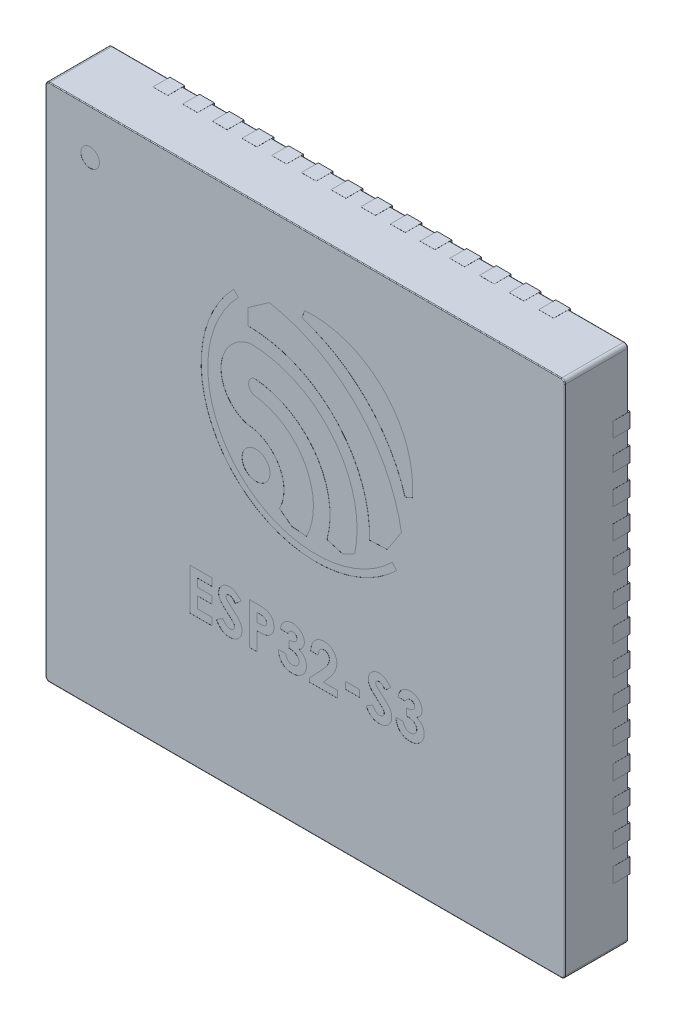
from build123d import *

# Parameters (mm, degrees)
SKETCH1_W                = 7
SKETCH1_H                = 7
BOSS_EXTRUDE1_DEPTH      = 0.85
FILLET1_R                = 0.05
FILLET2_R                = 0.01
BOSS_EXTRUDE2_DEPTH      = 0.025
BOSS_EXTRUDE2_DEPTH_BACK = 0.203
SKETCH2_W                = 0.2
SKETCH2_H                = 0.4
SKETCH2_W_2              = 0.4
SKETCH2_H_2              = 0.2
SKETCH3_R                = 0.125
SKETCH3_R_2              = 0.188076001
SKETCH3_W                = 0.193846154
SKETCH3_H                = 0.093333333
CUT_EXTRUDE1_DEPTH       = 0.001
BODY_MOVE_COPY1_ANGLE    = 180


with BuildPart() as part:
    # Sketch1 → Boss-Extrude1 (new body)
    with BuildSketch(Plane(origin=(0, 0, 0), x_dir=(1, 0, 0), z_dir=(0, 1, 0))):
        Rectangle(SKETCH1_W, SKETCH1_H)
    extrude(amount=BOSS_EXTRUDE1_DEPTH)

    # Fillet1
    fillet1_edges = [part.edges().sort_by_distance(p)[0] for p in [
        (3.5, 0.425, -3.5),
        (3.5, 0.425, 3.5),
        (-3.5, 0.425, 3.5),
        (-3.5, 0.425, -3.5),
    ]]
    fillet(fillet1_edges, radius=FILLET1_R)

    # Fillet2
    fillet2_edges = [part.edges().sort_by_distance(p)[0] for p in [
        (3.485355339, 0.85, 3.485355339),
        (0, 0.85, 3.5),
        (-3.485355339, 0.85, 3.485355339),
        (-3.5, 0.85, 0),
        (-3.485355339, 0.85, -3.485355339),
        (0, 0.85, -3.5),
        (3.485355339, 0.85, -3.485355339),
        (3.5, 0.85, 0),
        (3.5, 0, 0),
        (3.485355339, 0, -3.485355339),
        (0, 0, -3.5),
        (3.485355339, 0, 3.485355339),
        (0, 0, 3.5),
        (-3.485355339, 0, 3.485355339),
        (-3.5, 0, 0),
        (-3.485355339, 0, -3.485355339),
    ]]
    fillet(fillet2_edges, radius=FILLET2_R)

    # Sketch2 → Boss-Extrude2 (add, two sides: drawn at the far end of the back side and taken through both)
    with BuildSketch(Plane.XZ.offset(-BOSS_EXTRUDE2_DEPTH_BACK)):
        with BuildLine():
            Line((1.5, 2), (2, 1.5))
            Line((2, 1.5), (2, -1.875))
            ThreePointArc((2, -1.875), (1.963388348, -1.963388348), (1.875, -2))
            Line((1.875, -2), (-1.875, -2))
            ThreePointArc((-1.875, -2), (-1.963388348, -1.963388348), (-2, -1.875))
            Line((-2, -1.875), (-2, 1.875))
            ThreePointArc((-2, 1.875), (-1.963388348, 1.963388348), (-1.875, 2))
            Line((-1.875, 2), (1.5, 2))
        make_face()
        with Locations((-1.8, 3.301)):
            Rectangle(SKETCH2_W, SKETCH2_H)
        with Locations((-0.2, 3.301)):
            Rectangle(SKETCH2_W, SKETCH2_H)
        with Locations((-0.6, 3.301)):
            Rectangle(SKETCH2_W, SKETCH2_H)
        with Locations((-1, 3.301)):
            Rectangle(SKETCH2_W, SKETCH2_H)
        with Locations((-1.4, 3.301)):
            Rectangle(SKETCH2_W, SKETCH2_H)
        with Locations((-2.2, 3.301)):
            Rectangle(SKETCH2_W, SKETCH2_H)
        with Locations((-2.6, 3.301)):
            Rectangle(SKETCH2_W, SKETCH2_H)
        with Locations((2.6, 3.301)):
            Rectangle(SKETCH2_W, SKETCH2_H)
        with Locations((2.2, 3.301)):
            Rectangle(SKETCH2_W, SKETCH2_H)
        with Locations((1.8, 3.301)):
            Rectangle(SKETCH2_W, SKETCH2_H)
        with Locations((1.4, 3.301)):
            Rectangle(SKETCH2_W, SKETCH2_H)
        with Locations((1, 3.301)):
            Rectangle(SKETCH2_W, SKETCH2_H)
        with Locations((0.6, 3.301)):
            Rectangle(SKETCH2_W, SKETCH2_H)
        with Locations((0.2, 3.301)):
            Rectangle(SKETCH2_W, SKETCH2_H)
        with Locations((1.8, -3.301)):
            Rectangle(SKETCH2_W, SKETCH2_H)
        with Locations((0.2, -3.301)):
            Rectangle(SKETCH2_W, SKETCH2_H)
        with Locations((0.6, -3.301)):
            Rectangle(SKETCH2_W, SKETCH2_H)
        with Locations((1, -3.301)):
            Rectangle(SKETCH2_W, SKETCH2_H)
        with Locations((1.4, -3.301)):
            Rectangle(SKETCH2_W, SKETCH2_H)
        with Locations((2.2, -3.301)):
            Rectangle(SKETCH2_W, SKETCH2_H)
        with Locations((2.6, -3.301)):
            Rectangle(SKETCH2_W, SKETCH2_H)
        with Locations((-2.6, -3.301)):
            Rectangle(SKETCH2_W, SKETCH2_H)
        with Locations((-2.2, -3.301)):
            Rectangle(SKETCH2_W, SKETCH2_H)
        with Locations((-1.8, -3.301)):
            Rectangle(SKETCH2_W, SKETCH2_H)
        with Locations((-1.4, -3.301)):
            Rectangle(SKETCH2_W, SKETCH2_H)
        with Locations((-1, -3.301)):
            Rectangle(SKETCH2_W, SKETCH2_H)
        with Locations((-0.6, -3.301)):
            Rectangle(SKETCH2_W, SKETCH2_H)
        with Locations((-0.2, -3.301)):
            Rectangle(SKETCH2_W, SKETCH2_H)
        with Locations((3.301, 1.8)):
            Rectangle(SKETCH2_W_2, SKETCH2_H_2)
        with Locations((3.301, 0.2)):
            Rectangle(SKETCH2_W_2, SKETCH2_H_2)
        with Locations((3.301, 0.6)):
            Rectangle(SKETCH2_W_2, SKETCH2_H_2)
        with Locations((3.301, 1)):
            Rectangle(SKETCH2_W_2, SKETCH2_H_2)
        with Locations((3.301, 1.4)):
            Rectangle(SKETCH2_W_2, SKETCH2_H_2)
        with Locations((3.301, 2.2)):
            Rectangle(SKETCH2_W_2, SKETCH2_H_2)
        with Locations((3.301, 2.6)):
            Rectangle(SKETCH2_W_2, SKETCH2_H_2)
        with Locations((3.301, -2.6)):
            Rectangle(SKETCH2_W_2, SKETCH2_H_2)
        with Locations((3.301, -2.2)):
            Rectangle(SKETCH2_W_2, SKETCH2_H_2)
        with Locations((3.301, -1.8)):
            Rectangle(SKETCH2_W_2, SKETCH2_H_2)
        with Locations((3.301, -1.4)):
            Rectangle(SKETCH2_W_2, SKETCH2_H_2)
        with Locations((3.301, -1)):
            Rectangle(SKETCH2_W_2, SKETCH2_H_2)
        with Locations((3.301, -0.6)):
            Rectangle(SKETCH2_W_2, SKETCH2_H_2)
        with Locations((3.301, -0.2)):
            Rectangle(SKETCH2_W_2, SKETCH2_H_2)
        with Locations((-3.301, -1.8)):
            Rectangle(SKETCH2_W_2, SKETCH2_H_2)
        with Locations((-3.301, -0.2)):
            Rectangle(SKETCH2_W_2, SKETCH2_H_2)
        with Locations((-3.301, -0.6)):
            Rectangle(SKETCH2_W_2, SKETCH2_H_2)
        with Locations((-3.301, -1)):
            Rectangle(SKETCH2_W_2, SKETCH2_H_2)
        with Locations((-3.301, -1.4)):
            Rectangle(SKETCH2_W_2, SKETCH2_H_2)
        with Locations((-3.301, -2.2)):
            Rectangle(SKETCH2_W_2, SKETCH2_H_2)
        with Locations((-3.301, -2.6)):
            Rectangle(SKETCH2_W_2, SKETCH2_H_2)
        with Locations((-3.301, 2.6)):
            Rectangle(SKETCH2_W_2, SKETCH2_H_2)
        with Locations((-3.301, 2.2)):
            Rectangle(SKETCH2_W_2, SKETCH2_H_2)
        with Locations((-3.301, 1.8)):
            Rectangle(SKETCH2_W_2, SKETCH2_H_2)
        with Locations((-3.301, 1.4)):
            Rectangle(SKETCH2_W_2, SKETCH2_H_2)
        with Locations((-3.301, 1)):
            Rectangle(SKETCH2_W_2, SKETCH2_H_2)
        with Locations((-3.301, 0.6)):
            Rectangle(SKETCH2_W_2, SKETCH2_H_2)
        with Locations((-3.301, 0.2)):
            Rectangle(SKETCH2_W_2, SKETCH2_H_2)
    extrude(amount=BOSS_EXTRUDE2_DEPTH + BOSS_EXTRUDE2_DEPTH_BACK)

    # Sketch3 → Cut-Extrude1 (cut)
    # profile 1 of 14: a face of its own
    with BuildSketch(Plane(origin=(0, 0.85, 0), x_dir=(1, 0, 0), z_dir=(0, 1, 0))):
        with Locations((2.9, -2.9)):
            Circle(SKETCH3_R)
    # profile 2 of 14: a face of its own
    with BuildSketch(Plane(origin=(0, 0.85, 0), x_dir=(1, 0, 0), z_dir=(0, 1, 0))):
        with Locations((0.664078628, -0.425449032)):
            Circle(SKETCH3_R_2)
    # profile 3 of 14: a face of its own
    with BuildSketch(Plane(origin=(0, 0.85, 0), x_dir=(1, 0, 0), z_dir=(0, 1, 0))):
        with BuildLine():
            Line((-1.345453372, -1.058372856), (-1.442095372, -1.099532856))
            ThreePointArc((-1.442095372, -1.099532856), (-1.055784236, -2.166451597), (0.009128766, -2.558257916))
            Line((0.009128766, -2.558257916), (0.045964628, -2.455586856))
            ThreePointArc((0.045964628, -2.455586856), (-0.82393574, -1.930448634), (-1.345453372, -1.058372856))
        make_face()
    # profile 4 of 14: a face of its own
    with BuildSketch(Plane(origin=(0, 0.85, 0), x_dir=(1, 0, 0), z_dir=(0, 1, 0))):
        with BuildLine():
            Line((-0.865393373, -0.31652573), (-1.103575373, -0.32673173))
            Line((-1.103575373, -0.32673173), (-1.296061373, -0.62060573))
            ThreePointArc((-1.296061373, -0.62060573), (-0.688354885, -1.798140924), (0.484559366, -2.414718956))
            Line((0.484559366, -2.414718956), (0.773519366, -2.211984956))
            Line((0.773519366, -2.211984956), (0.773519366, -1.999002956))
            ThreePointArc((0.773519366, -1.999002956), (-0.40136049, -1.503984826), (-0.865393373, -0.31652573))
        make_face()
    # profile 5 of 14: a face of its own
    with BuildSketch(Plane(origin=(0, 0.85, 0), x_dir=(1, 0, 0), z_dir=(0, 1, 0))):
        with BuildLine():
            Line((0.900118628, -2.268686856), (0.967444628, -2.328242856))
            ThreePointArc((0.967444628, -2.328242856), (0.946483222, -0.151358963), (-1.230489433, -0.144084158))
            Line((-1.230489433, -0.144084158), (-1.170615649, -0.211137265))
            ThreePointArc((-1.170615649, -0.211137265), (0.883139766, -0.214997998), (0.900118628, -2.268686856))
        make_face()
    # profile 6 of 14: a face of its own
    with BuildSketch(Plane(origin=(0, 0.85, 0), x_dir=(1, 0, 0), z_dir=(0, 1, 0))):
        with BuildLine():
            Line((0.347863992, -0.078422998), (0.182131992, 0.046989002))
            Line((0.182131992, 0.046989002), (-0.016864008, 0.064503002))
            ThreePointArc((-0.016864008, 0.064503002), (0.001273533, -0.767793127), (0.692810421, -1.231282663))
            ThreePointArc((0.692810421, -1.231282663), (0.763213465, -1.331381618), (0.689094842, -1.428761385))
            ThreePointArc((0.689094842, -1.428761385), (-0.134535423, -0.967794579), (-0.291542491, -0.037092699))
            Line((-0.291542491, -0.037092699), (-0.501878492, 0.025529301))
            Line((-0.501878492, 0.025529301), (-0.665745659, -0.056488188))
            ThreePointArc((-0.665745659, -0.056488188), (-0.376661615, -1.270646283), (0.749385508, -1.808946699))
            ThreePointArc((0.749385508, -1.808946699), (1.135747099, -1.343767946), (0.790669837, -0.847191432))
            ThreePointArc((0.790669837, -0.847191432), (0.357913707, -0.584545349), (0.347863992, -0.078422998))
        make_face()
    # profile 7 of 14: a face of its own
    with BuildSketch(Plane(origin=(0, 0.85, 0), x_dir=(1, 0, 0), z_dir=(0, 1, 0))):
        with BuildLine():
            Line((-1.351153846, 1.321410256), (-1.250641026, 1.321410256))
            add(Edge.make_bspline(
                [(-1.250641026, 1.321410256), (-1.251346257, 1.31638488), (-1.252723749, 1.306569075), (-1.256110004, 1.29232424), (-1.260026001, 1.278778454), (-1.265034008, 1.266004411), (-1.270814849, 1.254015882), (-1.277556094, 1.242802139), (-1.284944945, 1.232202256), (-1.290729954, 1.225850074), (-1.293605769, 1.222692308)],
                knots=[0, 0, 0, 0, 1.1115466, 2.171125598, 3.205689823, 4.19946166, 5.17440286, 6.118867946, 7.064860634, 8, 8, 8, 8], degree=3))
            add(Edge.make_bspline(
                [(-1.293605769, 1.222692308), (-1.297743522, 1.218519423), (-1.305898599, 1.210295105), (-1.319526688, 1.199760662), (-1.333811443, 1.190643818), (-1.349039349, 1.183415918), (-1.36497345, 1.17756577), (-1.381740459, 1.173636213), (-1.399271859, 1.171028917), (-1.411234835, 1.170772089), (-1.417339744, 1.170641026)],
                knots=[0, 0, 0, 0, 1.01925491, 2.00884431, 2.983262333, 3.955970413, 4.92937149, 5.924503185, 6.940838805, 8, 8, 8, 8], degree=3))
            add(Edge.make_bspline(
                [(-1.417339744, 1.170641026), (-1.422767322, 1.17076916), (-1.433436847, 1.171021047), (-1.449118364, 1.173043056), (-1.464069379, 1.176589434), (-1.478447927, 1.181226244), (-1.492042547, 1.187535399), (-1.505153286, 1.194858985), (-1.517413829, 1.203841667), (-1.528852863, 1.213991195), (-1.539361798, 1.224968902), (-1.548462582, 1.236703169), (-1.556286689, 1.248880545), (-1.562732718, 1.261602201), (-1.567688838, 1.274889666), (-1.571128533, 1.288666177), (-1.573379896, 1.302901337), (-1.573604191, 1.312576783), (-1.573717949, 1.317483974)],
                knots=[0, 0, 0, 0, 1.091422571, 2.145516843, 3.172569842, 4.178562979, 5.178154469, 6.181868002, 7.194278174, 8.227918432, 9.254613415, 10.245994977, 11.209837596, 12.161663635, 13.10878368, 14.055455738, 15.013766427, 16, 16, 16, 16], degree=3))
            add(Edge.make_bspline(
                [(-1.573717949, 1.317483974), (-1.573480016, 1.323560043), (-1.573010166, 1.335558597), (-1.569294338, 1.35308482), (-1.563320933, 1.369804956), (-1.554827636, 1.385520895), (-1.544161911, 1.400216266), (-1.53108242, 1.413377824), (-1.51595416, 1.425209401), (-1.504597489, 1.431567771), (-1.498782051, 1.434823718)],
                knots=[0, 0, 0, 0, 0.992776698, 1.96045919, 2.915875678, 3.886951799, 4.871409521, 5.874469288, 6.911574252, 8, 8, 8, 8], degree=3))
            add(Edge.make_bspline(
                [(-1.498782051, 1.434823718), (-1.502773828, 1.436134086), (-1.510617491, 1.438708901), (-1.521764065, 1.443783103), (-1.532371909, 1.44931658), (-1.542198423, 1.455776324), (-1.551513076, 1.462714593), (-1.560021165, 1.470504437), (-1.567943006, 1.478945903), (-1.57508262, 1.488128793), (-1.581465766, 1.497900429), (-1.58709117, 1.50808518), (-1.591811942, 1.518720269), (-1.595774062, 1.529727542), (-1.598797049, 1.541215331), (-1.600923831, 1.553144704), (-1.602153563, 1.565486917), (-1.602341081, 1.573848817), (-1.602435897, 1.578076923)],
                knots=[0, 0, 0, 0, 1.059375415, 2.081625174, 3.086260357, 4.075579879, 5.045586876, 6.014170127, 6.982201689, 7.963705737, 8.945119069, 9.924852636, 10.896327119, 11.878239286, 12.873838556, 13.889973282, 14.933087432, 16, 16, 16, 16], degree=3))
            add(Edge.make_bspline(
                [(-1.602435897, 1.578076923), (-1.60226014, 1.584293248), (-1.601913435, 1.596555783), (-1.599266938, 1.614558426), (-1.59501622, 1.631814742), (-1.589044075, 1.648346481), (-1.581224663, 1.664103997), (-1.571780415, 1.67919325), (-1.560595946, 1.693495675), (-1.547840834, 1.706884554), (-1.533794441, 1.719171723), (-1.518663018, 1.730017034), (-1.502437062, 1.738959927), (-1.485503617, 1.746603029), (-1.467482617, 1.752275589), (-1.448606797, 1.756429633), (-1.428738423, 1.758957092), (-1.415178404, 1.759223115), (-1.408253205, 1.759358974)],
                knots=[0, 0, 0, 0, 1.005301618, 1.9830924, 2.936709333, 3.876255674, 4.820386332, 5.77704884, 6.75110905, 7.752325838, 8.764085485, 9.766124222, 10.757295257, 11.756573224, 12.766631673, 13.80722022, 14.880131728, 16, 16, 16, 16], degree=3))
            add(Edge.make_bspline(
                [(-1.408253205, 1.759358974), (-1.401701919, 1.759216098), (-1.388891745, 1.758936721), (-1.370154546, 1.756517437), (-1.352345241, 1.752617633), (-1.335424767, 1.747111183), (-1.319465162, 1.740016724), (-1.304373446, 1.731453593), (-1.290314373, 1.721159416), (-1.277223218, 1.709377071), (-1.265210963, 1.696340051), (-1.254741814, 1.68194209), (-1.245630895, 1.666497797), (-1.237818074, 1.649973957), (-1.231713749, 1.632223135), (-1.226859141, 1.613403851), (-1.223479362, 1.59343473), (-1.222448612, 1.579696731), (-1.221923077, 1.572692308)],
                knots=[0, 0, 0, 0, 1.066693477, 2.085777942, 3.071407889, 4.032495163, 4.978645371, 5.911608997, 6.853298848, 7.810770565, 8.776420673, 9.735131334, 10.704462168, 11.693492242, 12.70668109, 13.756973703, 14.856375978, 16, 16, 16, 16], degree=3))
            Line((-1.221923077, 1.572692308), (-1.322435897, 1.572692308))
            add(Edge.make_bspline(
                [(-1.322435897, 1.572692308), (-1.323072961, 1.576214216), (-1.324313809, 1.583074056), (-1.326731819, 1.593006556), (-1.329891111, 1.602171259), (-1.333503118, 1.610635496), (-1.337496617, 1.618486133), (-1.342268155, 1.625513229), (-1.347384303, 1.631992951), (-1.355075039, 1.639440955), (-1.365805377, 1.647251761), (-1.380333625, 1.654169369), (-1.396568649, 1.658103673), (-1.407895523, 1.658593157), (-1.41375, 1.658846154)],
                knots=[0, 0, 0, 0, 0.928450228, 1.808400301, 2.64896863, 3.43999153, 4.194978884, 4.9294959, 5.640047715, 6.332896648, 7.70085756, 9.063442004, 10.482192841, 12, 12, 12, 12], degree=3))
            add(Edge.make_bspline(
                [(-1.41375, 1.658846154), (-1.41685707, 1.658792688), (-1.422943125, 1.658687961), (-1.431884102, 1.657533761), (-1.440396028, 1.655619089), (-1.448567815, 1.653049077), (-1.456288002, 1.649660046), (-1.463655286, 1.645629814), (-1.470538579, 1.640730342), (-1.476959562, 1.635205485), (-1.482770605, 1.629121647), (-1.488026374, 1.622766676), (-1.492244644, 1.615880904), (-1.495746152, 1.608736641), (-1.498634475, 1.601335735), (-1.500446602, 1.593509792), (-1.50180331, 1.58541567), (-1.501882756, 1.57987786), (-1.501923077, 1.577067308)],
                knots=[0, 0, 0, 0, 1.110416125, 2.175056767, 3.216269732, 4.226816172, 5.232753079, 6.226173397, 7.223992381, 8.247806573, 9.250094092, 10.229378924, 11.190237183, 12.128982156, 13.072570213, 14.022671385, 14.996464856, 16, 16, 16, 16], degree=3))
            add(Edge.make_bspline(
                [(-1.501923077, 1.577067308), (-1.5018207, 1.573992444), (-1.501618115, 1.567907875), (-1.499835379, 1.55899123), (-1.497166887, 1.550380922), (-1.493329099, 1.542147992), (-1.488307183, 1.53434086), (-1.482201048, 1.526894865), (-1.474955457, 1.519869291), (-1.466813045, 1.513059525), (-1.457445279, 1.507098287), (-1.447230445, 1.501608879), (-1.435916893, 1.497237957), (-1.423776035, 1.493334868), (-1.410579595, 1.490483874), (-1.39640912, 1.488413844), (-1.381287585, 1.486873006), (-1.37086411, 1.48665195), (-1.365512821, 1.486538462)],
                knots=[0, 0, 0, 0, 0.809868251, 1.602574917, 2.388262527, 3.182133002, 3.988875265, 4.829537611, 5.714850619, 6.646378958, 7.622533229, 8.636771727, 9.698525113, 10.814716514, 11.996253919, 13.252421425, 14.589425562, 16, 16, 16, 16], degree=3))
            Line((-1.365512821, 1.486538462), (-1.365512821, 1.393205128))
            add(Edge.make_bspline(
                [(-1.365512821, 1.393205128), (-1.372176162, 1.392639313), (-1.384641954, 1.391580786), (-1.401935353, 1.389079115), (-1.416571558, 1.385808292), (-1.428707903, 1.381618366), (-1.438936119, 1.376701252), (-1.447643795, 1.370867557), (-1.455395795, 1.364408107), (-1.461724749, 1.356988747), (-1.466839128, 1.349156802), (-1.470460484, 1.340933841), (-1.472864382, 1.332502667), (-1.47309223, 1.326735729), (-1.473205128, 1.323878205)],
                knots=[0, 0, 0, 0, 1.700278244, 3.18088388, 4.44026007, 5.507838349, 6.439172496, 7.317391478, 8.167251366, 8.996486918, 9.787781501, 10.536992524, 11.275078289, 12, 12, 12, 12], degree=3))
            add(Edge.make_bspline(
                [(-1.473205128, 1.323878205), (-1.473014838, 1.320229987), (-1.472643433, 1.313109438), (-1.469624836, 1.302943573), (-1.464720467, 1.293731269), (-1.457815245, 1.285790118), (-1.44936655, 1.279233465), (-1.439524209, 1.274454531), (-1.428455097, 1.271595999), (-1.420685138, 1.271304568), (-1.416666667, 1.271153846)],
                knots=[0, 0, 0, 0, 1.008776249, 1.968917671, 2.909425455, 3.878736958, 4.86052431, 5.85160606, 6.888892716, 8, 8, 8, 8], degree=3))
            add(Edge.make_bspline(
                [(-1.416666667, 1.271153846), (-1.413024552, 1.271332707), (-1.405797481, 1.271687623), (-1.395233606, 1.274348407), (-1.385213, 1.278782228), (-1.375992651, 1.285008571), (-1.367595235, 1.292409334), (-1.360554172, 1.301103458), (-1.354822311, 1.310750882), (-1.352381461, 1.317843202), (-1.351153846, 1.321410256)],
                knots=[0, 0, 0, 0, 0.988439209, 1.961366134, 2.938893463, 3.950078543, 4.971412263, 5.967491143, 6.977757845, 8, 8, 8, 8], degree=3))
        make_face()
    # profile 8 of 14: a face of its own
    with BuildSketch(Plane(origin=(0, 0.85, 0), x_dir=(1, 0, 0), z_dir=(0, 1, 0))):
        with BuildLine():
            Line((-1.150128205, 1.259823718), (-1.074967949, 1.328589744))
            add(Edge.make_bspline(
                [(-1.074967949, 1.328589744), (-1.071749025, 1.324047432), (-1.065569141, 1.315326827), (-1.055542124, 1.303662479), (-1.045575011, 1.293646645), (-1.035464015, 1.285565689), (-1.025383215, 1.279060264), (-1.015118439, 1.274573211), (-1.004787777, 1.27168756), (-0.997843521, 1.271329977), (-0.994423077, 1.271153846)],
                knots=[0, 0, 0, 0, 1.299459705, 2.494781419, 3.587730629, 4.594196874, 5.512431013, 6.380462003, 7.202284646, 8, 8, 8, 8], degree=3))
            add(Edge.make_bspline(
                [(-0.994423077, 1.271153846), (-0.991231278, 1.271262401), (-0.985068752, 1.271471991), (-0.976324536, 1.273660135), (-0.96846638, 1.277196059), (-0.961703605, 1.282080374), (-0.956263099, 1.287913663), (-0.952032781, 1.294123483), (-0.949574535, 1.300894233), (-0.949258848, 1.305537731), (-0.949102564, 1.307836538)],
                knots=[0, 0, 0, 0, 1.184157716, 2.286297433, 3.324836695, 4.370048774, 5.362957217, 6.276446515, 7.146738784, 8, 8, 8, 8], degree=3))
            add(Edge.make_bspline(
                [(-0.949102564, 1.307836538), (-0.949201492, 1.310167416), (-0.949400718, 1.314861481), (-0.951324973, 1.321741217), (-0.954225375, 1.32846352), (-0.956996827, 1.332555705), (-0.958413462, 1.334647436)],
                knots=[0, 0, 0, 0, 0.967525499, 1.948461899, 2.951351359, 4, 4, 4, 4], degree=3))
            add(Edge.make_bspline(
                [(-0.958413462, 1.334647436), (-0.959706529, 1.336268479), (-0.962700198, 1.340021467), (-0.968235031, 1.346060545), (-0.975472159, 1.353150087), (-0.984105696, 1.361647315), (-0.994459644, 1.371222165), (-1.006311699, 1.382151867), (-1.019925554, 1.394065148), (-1.02946345, 1.402475381), (-1.034471154, 1.406891026)],
                knots=[0, 0, 0, 0, 0.473849886, 1.097042329, 1.870584189, 2.789244661, 3.865562256, 5.093556389, 6.47402294, 8, 8, 8, 8], degree=3))
            add(Edge.make_bspline(
                [(-1.034471154, 1.406891026), (-1.039182868, 1.410966692), (-1.048124722, 1.41870146), (-1.06083108, 1.429697774), (-1.072070558, 1.439546488), (-1.081740938, 1.448321352), (-1.090131193, 1.455661006), (-1.096870242, 1.462016995), (-1.102246501, 1.467111273), (-1.105299587, 1.470191745), (-1.106602564, 1.47150641)],
                knots=[0, 0, 0, 0, 1.543627419, 2.929484142, 4.163674036, 5.24627963, 6.164986907, 6.925413438, 7.541394495, 8, 8, 8, 8], degree=3))
            add(Edge.make_bspline(
                [(-1.106602564, 1.47150641), (-1.111548836, 1.476855134), (-1.121057308, 1.48713726), (-1.133390745, 1.503114456), (-1.143650973, 1.518590879), (-1.151596469, 1.53400356), (-1.157358894, 1.549671015), (-1.161553735, 1.56581678), (-1.164068137, 1.582671707), (-1.164346424, 1.594147543), (-1.164487179, 1.599951923)],
                knots=[0, 0, 0, 0, 1.206413378, 2.319150186, 3.339784753, 4.27899982, 5.184598145, 6.099639703, 7.038813909, 8, 8, 8, 8], degree=3))
            add(Edge.make_bspline(
                [(-1.164487179, 1.599951923), (-1.16438687, 1.605607626), (-1.16419006, 1.616704326), (-1.161782121, 1.632943448), (-1.158343634, 1.648482109), (-1.15304533, 1.663164645), (-1.146533298, 1.677165054), (-1.138596701, 1.690488046), (-1.128893418, 1.702822581), (-1.118115899, 1.714501479), (-1.106008493, 1.724984508), (-1.092989133, 1.73422665), (-1.079033025, 1.742030022), (-1.064246525, 1.748460805), (-1.048444187, 1.753233156), (-1.031875648, 1.756841331), (-1.014373974, 1.759016891), (-1.002431403, 1.759243304), (-0.996330128, 1.759358974)],
                knots=[0, 0, 0, 0, 1.043039441, 2.046482205, 3.024244422, 3.976033659, 4.920890471, 5.871402525, 6.830893638, 7.812473116, 8.800703348, 9.781190227, 10.754606487, 11.746997808, 12.751247331, 13.796362838, 14.874195872, 16, 16, 16, 16], degree=3))
            add(Edge.make_bspline(
                [(-0.996330128, 1.759358974), (-0.991540609, 1.759274098), (-0.982054614, 1.759105993), (-0.968074352, 1.757730742), (-0.954572299, 1.755518228), (-0.941575423, 1.752322605), (-0.929001509, 1.748365885), (-0.916987014, 1.743220735), (-0.905372197, 1.73740225), (-0.894195684, 1.730659569), (-0.883550088, 1.722828599), (-0.873128691, 1.714218424), (-0.863300942, 1.704356812), (-0.853691349, 1.693603273), (-0.844701255, 1.681646143), (-0.835856932, 1.668845223), (-0.827590046, 1.654894499), (-0.822481253, 1.645109923), (-0.819871795, 1.640112179)],
                knots=[0, 0, 0, 0, 1.017088714, 2.014418954, 2.980620591, 3.920647918, 4.854987948, 5.776890852, 6.693269322, 7.612671471, 8.545186947, 9.498010697, 10.480815007, 11.499174288, 12.558697099, 13.655746277, 14.802607237, 16, 16, 16, 16], degree=3))
            Line((-0.819871795, 1.640112179), (-0.908269231, 1.587051282))
            add(Edge.make_bspline(
                [(-0.908269231, 1.587051282), (-0.91153304, 1.592724564), (-0.917790043, 1.603600731), (-0.928393118, 1.61821424), (-0.939255427, 1.630728291), (-0.950628097, 1.640921698), (-0.96237284, 1.64893076), (-0.974546387, 1.654654591), (-0.98715729, 1.658197636), (-0.995747264, 1.658630324), (-1.000032051, 1.658846154)],
                knots=[0, 0, 0, 0, 1.283663364, 2.460892379, 3.537111102, 4.529833553, 5.449777664, 6.316464042, 7.160231139, 8, 8, 8, 8], degree=3))
            add(Edge.make_bspline(
                [(-1.000032051, 1.658846154), (-1.004391096, 1.65867157), (-1.012848277, 1.658332853), (-1.024939693, 1.655142476), (-1.036074146, 1.650245668), (-1.045646949, 1.643124015), (-1.053776098, 1.635003258), (-1.059603863, 1.625844323), (-1.06338413, 1.616053536), (-1.063776846, 1.609221419), (-1.063974359, 1.605785256)],
                knots=[0, 0, 0, 0, 1.13537643, 2.202795631, 3.242191317, 4.290390765, 5.297919085, 6.223733717, 7.106639842, 8, 8, 8, 8], degree=3))
            add(Edge.make_bspline(
                [(-1.063974359, 1.605785256), (-1.063789481, 1.60259007), (-1.063413918, 1.596099356), (-1.060662697, 1.586443104), (-1.056325607, 1.576833675), (-1.051348288, 1.568868342), (-1.046159164, 1.562228906), (-1.041072828, 1.556562636), (-1.035044641, 1.55017142), (-1.027921, 1.543229538), (-1.01984046, 1.535603522), (-1.010776565, 1.527311501), (-1.000631708, 1.51842107), (-0.993461014, 1.512365243), (-0.989711538, 1.509198718)],
                knots=[0, 0, 0, 0, 0.916057066, 1.860882232, 2.859899639, 3.934694552, 4.546382938, 5.276161949, 6.118633209, 7.067046139, 8.129668089, 9.306861125, 10.591787583, 12, 12, 12, 12], degree=3))
            add(Edge.make_bspline(
                [(-0.989711538, 1.509198718), (-0.982583902, 1.503167658), (-0.968903811, 1.49159223), (-0.949568655, 1.474499071), (-0.932158077, 1.45851205), (-0.916788193, 1.443503271), (-0.903413348, 1.42956863), (-0.891886302, 1.416830459), (-0.882393328, 1.405038965), (-0.872549695, 1.390955421), (-0.862932178, 1.374035709), (-0.854758657, 1.35358371), (-0.849476246, 1.333157319), (-0.848882152, 1.319421115), (-0.848589744, 1.312660256)],
                knots=[0, 0, 0, 0, 1.345685333, 2.582777463, 3.719355561, 4.752181389, 5.678433858, 6.502864483, 7.227563063, 7.858499643, 8.978226409, 10.023061349, 11.026965269, 12, 12, 12, 12], degree=3))
            add(Edge.make_bspline(
                [(-0.848589744, 1.312660256), (-0.848711413, 1.307865931), (-0.848951115, 1.298420595), (-0.851082959, 1.284530977), (-0.8542839, 1.271134996), (-0.858883849, 1.258236044), (-0.865053641, 1.245979431), (-0.872341296, 1.234166784), (-0.880954327, 1.222834207), (-0.890825775, 1.21223309), (-0.901661908, 1.202487997), (-0.913219698, 1.193938221), (-0.92539236, 1.186708558), (-0.938216808, 1.18081886), (-0.951670349, 1.17622284), (-0.965765408, 1.172974759), (-0.980458793, 1.1710378), (-0.990453528, 1.170774931), (-0.995544872, 1.170641026)],
                knots=[0, 0, 0, 0, 1.010806554, 1.991397492, 2.957573065, 3.913225829, 4.872777376, 5.846906201, 6.837692339, 7.870332167, 8.898170327, 9.907899016, 10.8981826, 11.879407896, 12.8797257, 13.891947133, 14.926152479, 16, 16, 16, 16], degree=3))
            add(Edge.make_bspline(
                [(-0.995544872, 1.170641026), (-1.00214261, 1.170883042), (-1.015286007, 1.171365165), (-1.034724651, 1.175115545), (-1.053720853, 1.181075637), (-1.069075753, 1.188096356), (-1.08118825, 1.19511415), (-1.090493914, 1.201444158), (-1.100036773, 1.20871318), (-1.109641636, 1.217132748), (-1.119672723, 1.22621616), (-1.129623355, 1.236586776), (-1.139980803, 1.247713237), (-1.146686482, 1.255716172), (-1.150128205, 1.259823718)],
                knots=[0, 0, 0, 0, 1.282890948, 2.555655204, 3.837225328, 5.149160694, 5.83044799, 6.558852598, 7.337307105, 8.162686284, 9.043076448, 9.969084596, 10.957622644, 12, 12, 12, 12], degree=3))
        make_face()
    # profile 9 of 14: a face of its own
    with BuildSketch(Plane(origin=(0, 0.85, 0), x_dir=(1, 0, 0), z_dir=(0, 1, 0))):
        with Locations((-0.636794872, 1.540384616)):
            Rectangle(SKETCH3_W, SKETCH3_H)
    # profile 10 of 14: a face of its own
    with BuildSketch(Plane(origin=(0, 0.85, 0), x_dir=(1, 0, 0), z_dir=(0, 1, 0))):
        with BuildLine():
            Line((-0.173717949, 1.371666667), (-0.073205128, 1.371666667))
            add(Edge.make_bspline(
                [(-0.073205128, 1.371666667), (-0.073639057, 1.364063324), (-0.074486928, 1.349206849), (-0.077863245, 1.327628677), (-0.082375769, 1.307234689), (-0.088449737, 1.288086197), (-0.095931192, 1.270175155), (-0.105006338, 1.253560894), (-0.115404223, 1.238124364), (-0.127334437, 1.224136291), (-0.14031279, 1.211560588), (-0.15430601, 1.200566579), (-0.169274346, 1.191363155), (-0.18511771, 1.183813544), (-0.20177387, 1.177772883), (-0.219411114, 1.173736339), (-0.237873816, 1.17100216), (-0.250513142, 1.170762947), (-0.256955128, 1.170641026)],
                knots=[0, 0, 0, 0, 1.198928049, 2.342633425, 3.435730849, 4.486331048, 5.502589352, 6.488331875, 7.46361919, 8.428949135, 9.378681775, 10.305958057, 11.226249248, 12.140413166, 13.066341608, 14.010670971, 14.986082777, 16, 16, 16, 16], degree=3))
            add(Edge.make_bspline(
                [(-0.256955128, 1.170641026), (-0.264865952, 1.170871577), (-0.280316519, 1.171321865), (-0.302695722, 1.175657307), (-0.323729469, 1.182335589), (-0.343209904, 1.191940864), (-0.361034926, 1.204108445), (-0.376992635, 1.218771945), (-0.391156269, 1.235751496), (-0.403058901, 1.254922995), (-0.412740054, 1.27529442), (-0.419730067, 1.296236112), (-0.424270194, 1.317325828), (-0.424757777, 1.331521527), (-0.425, 1.338573718)],
                knots=[0, 0, 0, 0, 1.075206757, 2.099977874, 3.089436832, 4.070080219, 5.043757236, 6.01602434, 7.009399377, 8.042659726, 9.078134622, 10.07077983, 11.041594984, 12, 12, 12, 12], degree=3))
            add(Edge.make_bspline(
                [(-0.425, 1.338573718), (-0.424906048, 1.342839629), (-0.424716947, 1.351425853), (-0.423402099, 1.364418918), (-0.421429567, 1.377653874), (-0.418455469, 1.391119373), (-0.414746528, 1.404819191), (-0.410247032, 1.418794317), (-0.40485268, 1.432965562), (-0.398653225, 1.447492238), (-0.391258153, 1.462422243), (-0.382643945, 1.477976354), (-0.372572907, 1.49419737), (-0.361143362, 1.511034789), (-0.348435824, 1.52861919), (-0.334256869, 1.546742314), (-0.318788096, 1.565608767), (-0.307805855, 1.578217479), (-0.302163462, 1.584695513)],
                knots=[0, 0, 0, 0, 0.728286467, 1.465860763, 2.227952348, 3.011875114, 3.818782069, 4.650637576, 5.517456182, 6.406927181, 7.346324104, 8.360844784, 9.441645378, 10.605053135, 11.834886952, 13.145197974, 14.533275831, 16, 16, 16, 16], degree=3))
            Line((-0.302163462, 1.584695513), (-0.243717949, 1.651666667))
            Line((-0.243717949, 1.651666667), (-0.432179487, 1.651666667))
            Line((-0.432179487, 1.651666667), (-0.432179487, 1.745))
            Line((-0.432179487, 1.745), (-0.058846154, 1.745))
            Line((-0.058846154, 1.745), (-0.058846154, 1.694070513))
            Line((-0.058846154, 1.694070513), (-0.224647436, 1.517612179))
            add(Edge.make_bspline(
                [(-0.224647436, 1.517612179), (-0.229447885, 1.512464886), (-0.238744932, 1.502496106), (-0.251972436, 1.487855055), (-0.263946564, 1.473964046), (-0.274399577, 1.46066199), (-0.28396391, 1.448399276), (-0.291965178, 1.436712327), (-0.298933303, 1.425930269), (-0.306212245, 1.412787369), (-0.31328393, 1.397230513), (-0.319768552, 1.379319453), (-0.323681755, 1.362188601), (-0.324226059, 1.351005785), (-0.324487179, 1.345641026)],
                knots=[0, 0, 0, 0, 1.246192343, 2.413505005, 3.49357156, 4.492416076, 5.408771964, 6.246246772, 6.999304986, 7.680960093, 8.904522682, 10.020616941, 11.0504258, 12, 12, 12, 12], degree=3))
            add(Edge.make_bspline(
                [(-0.324487179, 1.345641026), (-0.324295502, 1.340449305), (-0.323924096, 1.330389515), (-0.319740907, 1.316121148), (-0.313481823, 1.303104564), (-0.30439482, 1.291932704), (-0.29342704, 1.282672272), (-0.280680656, 1.275886338), (-0.266389704, 1.271897924), (-0.256382179, 1.2714066), (-0.251233974, 1.271153846)],
                knots=[0, 0, 0, 0, 1.061596218, 2.057012874, 3.024113775, 4.006148568, 4.986025304, 5.949989669, 6.945406325, 8, 8, 8, 8], degree=3))
            add(Edge.make_bspline(
                [(-0.251233974, 1.271153846), (-0.248574871, 1.271247897), (-0.243339999, 1.271433052), (-0.235645145, 1.272665578), (-0.22832294, 1.274837775), (-0.221291882, 1.277748215), (-0.214627008, 1.281606023), (-0.20834513, 1.286361386), (-0.20238006, 1.291893459), (-0.196759156, 1.298184945), (-0.1916434, 1.305206245), (-0.187099604, 1.312893234), (-0.183342641, 1.321241141), (-0.180034874, 1.33013976), (-0.177483766, 1.339684669), (-0.175626243, 1.349818744), (-0.174214093, 1.360525498), (-0.173886339, 1.367885385), (-0.173717949, 1.371666667)],
                knots=[0, 0, 0, 0, 0.903469896, 1.778625579, 2.63899355, 3.493148037, 4.358286772, 5.247621495, 6.164656832, 7.118446693, 8.109501108, 9.111810964, 10.146451449, 11.215617525, 12.33435995, 13.498009769, 14.714554818, 16, 16, 16, 16], degree=3))
        make_face()
    # profile 11 of 14: a face of its own
    with BuildSketch(Plane(origin=(0, 0.85, 0), x_dir=(1, 0, 0), z_dir=(0, 1, 0))):
        with BuildLine():
            Line((0.235512821, 1.321410256), (0.336025641, 1.321410256))
            add(Edge.make_bspline(
                [(0.336025641, 1.321410256), (0.335320409, 1.31638488), (0.333942917, 1.306569075), (0.330556663, 1.29232424), (0.326640665, 1.278778454), (0.321632658, 1.266004411), (0.315851817, 1.254015882), (0.309110572, 1.242802139), (0.301721721, 1.232202256), (0.295936713, 1.225850074), (0.293060897, 1.222692308)],
                knots=[0, 0, 0, 0, 1.1115466, 2.171125598, 3.205689823, 4.19946166, 5.17440286, 6.118867946, 7.064860634, 8, 8, 8, 8], degree=3))
            add(Edge.make_bspline(
                [(0.293060897, 1.222692308), (0.288923144, 1.218519423), (0.280768068, 1.210295105), (0.267139979, 1.199760662), (0.252855224, 1.190643818), (0.237627318, 1.183415918), (0.221693217, 1.17756577), (0.204926208, 1.173636213), (0.187394808, 1.171028917), (0.175431832, 1.170772089), (0.169326923, 1.170641026)],
                knots=[0, 0, 0, 0, 1.01925491, 2.00884431, 2.983262333, 3.955970413, 4.92937149, 5.924503185, 6.940838805, 8, 8, 8, 8], degree=3))
            add(Edge.make_bspline(
                [(0.169326923, 1.170641026), (0.163899345, 1.17076916), (0.15322982, 1.171021047), (0.137548302, 1.173043056), (0.122597288, 1.176589434), (0.10821874, 1.181226244), (0.094624119, 1.187535399), (0.08151338, 1.194858985), (0.069252837, 1.203841667), (0.057813803, 1.213991195), (0.047304869, 1.224968902), (0.038204085, 1.236703169), (0.030379978, 1.248880545), (0.023933949, 1.261602201), (0.018977829, 1.274889666), (0.015538134, 1.288666177), (0.01328677, 1.302901337), (0.013062476, 1.312576783), (0.012948718, 1.317483974)],
                knots=[0, 0, 0, 0, 1.091422571, 2.145516843, 3.172569842, 4.178562979, 5.178154469, 6.181868002, 7.194278174, 8.227918432, 9.254613415, 10.245994977, 11.209837596, 12.161663635, 13.10878368, 14.055455738, 15.013766427, 16, 16, 16, 16], degree=3))
            add(Edge.make_bspline(
                [(0.012948718, 1.317483974), (0.01318665, 1.323560043), (0.013656501, 1.335558597), (0.017372329, 1.35308482), (0.023345734, 1.369804956), (0.031839031, 1.385520895), (0.042504756, 1.400216266), (0.055584247, 1.413377824), (0.070712507, 1.425209401), (0.082069177, 1.431567771), (0.087884615, 1.434823718)],
                knots=[0, 0, 0, 0, 0.992776698, 1.96045919, 2.915875678, 3.886951799, 4.871409521, 5.874469288, 6.911574252, 8, 8, 8, 8], degree=3))
            add(Edge.make_bspline(
                [(0.087884615, 1.434823718), (0.083892839, 1.436134086), (0.076049176, 1.438708901), (0.064902601, 1.443783103), (0.054294758, 1.44931658), (0.044468244, 1.455776324), (0.035153591, 1.462714593), (0.026645501, 1.470504437), (0.018723661, 1.478945903), (0.011584047, 1.488128793), (0.005200901, 1.497900429), (-0.000424504, 1.50808518), (-0.005145275, 1.518720269), (-0.009107395, 1.529727542), (-0.012130383, 1.541215331), (-0.014257164, 1.553144704), (-0.015486896, 1.565486917), (-0.015674414, 1.573848817), (-0.015769231, 1.578076923)],
                knots=[0, 0, 0, 0, 1.059375415, 2.081625174, 3.086260357, 4.075579879, 5.045586876, 6.014170127, 6.982201689, 7.963705737, 8.945119069, 9.924852636, 10.896327119, 11.878239286, 12.873838556, 13.889973282, 14.933087432, 16, 16, 16, 16], degree=3))
            add(Edge.make_bspline(
                [(-0.015769231, 1.578076923), (-0.015593473, 1.584293248), (-0.015246769, 1.596555783), (-0.012600271, 1.614558426), (-0.008349553, 1.631814742), (-0.002377408, 1.648346481), (0.005442003, 1.664103997), (0.014886251, 1.67919325), (0.02607072, 1.693495675), (0.038825832, 1.706884554), (0.052872225, 1.719171723), (0.068003649, 1.730017034), (0.084229604, 1.738959927), (0.101163049, 1.746603029), (0.11918405, 1.752275589), (0.13805987, 1.756429633), (0.157928244, 1.758957092), (0.171488263, 1.759223115), (0.178413462, 1.759358974)],
                knots=[0, 0, 0, 0, 1.005301618, 1.9830924, 2.936709333, 3.876255674, 4.820386332, 5.77704884, 6.75110905, 7.752325838, 8.764085485, 9.766124222, 10.757295257, 11.756573224, 12.766631673, 13.80722022, 14.880131728, 16, 16, 16, 16], degree=3))
            add(Edge.make_bspline(
                [(0.178413462, 1.759358974), (0.184964748, 1.759216098), (0.197774922, 1.758936721), (0.216512121, 1.756517437), (0.234321426, 1.752617633), (0.2512419, 1.747111183), (0.267201504, 1.740016724), (0.282293221, 1.731453593), (0.296352293, 1.721159416), (0.309443449, 1.709377071), (0.321455703, 1.696340051), (0.331924853, 1.68194209), (0.341035772, 1.666497797), (0.348848592, 1.649973957), (0.354952918, 1.632223135), (0.359807526, 1.613403851), (0.363187305, 1.59343473), (0.364218054, 1.579696731), (0.36474359, 1.572692308)],
                knots=[0, 0, 0, 0, 1.066693477, 2.085777942, 3.071407889, 4.032495163, 4.978645371, 5.911608997, 6.853298848, 7.810770565, 8.776420673, 9.735131334, 10.704462168, 11.693492242, 12.70668109, 13.756973703, 14.856375978, 16, 16, 16, 16], degree=3))
            Line((0.36474359, 1.572692308), (0.264230769, 1.572692308))
            add(Edge.make_bspline(
                [(0.264230769, 1.572692308), (0.263593706, 1.576214216), (0.262352858, 1.583074056), (0.259934848, 1.593006556), (0.256775556, 1.602171259), (0.253163548, 1.610635496), (0.24917005, 1.618486133), (0.244398511, 1.625513229), (0.239282364, 1.631992951), (0.231591628, 1.639440955), (0.220861289, 1.647251761), (0.206333042, 1.654169369), (0.190098017, 1.658103673), (0.178771143, 1.658593157), (0.172916667, 1.658846154)],
                knots=[0, 0, 0, 0, 0.928450228, 1.808400301, 2.64896863, 3.43999153, 4.194978884, 4.9294959, 5.640047715, 6.332896648, 7.70085756, 9.063442004, 10.482192841, 12, 12, 12, 12], degree=3))
            add(Edge.make_bspline(
                [(0.172916667, 1.658846154), (0.169809597, 1.658792688), (0.163723541, 1.658687961), (0.154782564, 1.657533761), (0.146270639, 1.655619089), (0.138098852, 1.653049077), (0.130378665, 1.649660046), (0.12301138, 1.645629814), (0.116128088, 1.640730342), (0.109707105, 1.635205485), (0.103896062, 1.629121647), (0.098640292, 1.622766676), (0.094422023, 1.615880904), (0.090920515, 1.608736641), (0.088032192, 1.601335735), (0.086220065, 1.593509792), (0.084863356, 1.58541567), (0.08478391, 1.57987786), (0.08474359, 1.577067308)],
                knots=[0, 0, 0, 0, 1.110416125, 2.175056767, 3.216269732, 4.226816172, 5.232753079, 6.226173397, 7.223992381, 8.247806573, 9.250094092, 10.229378924, 11.190237183, 12.128982156, 13.072570213, 14.022671385, 14.996464856, 16, 16, 16, 16], degree=3))
            add(Edge.make_bspline(
                [(0.08474359, 1.577067308), (0.084845967, 1.573992444), (0.085048552, 1.567907875), (0.086831287, 1.55899123), (0.08949978, 1.550380922), (0.093337568, 1.542147992), (0.098359484, 1.53434086), (0.104465618, 1.526894865), (0.11171121, 1.519869291), (0.119853622, 1.513059525), (0.129221388, 1.507098287), (0.139436221, 1.501608879), (0.150749774, 1.497237957), (0.162890632, 1.493334868), (0.176087072, 1.490483874), (0.190257547, 1.488413844), (0.205379082, 1.486873006), (0.215802557, 1.48665195), (0.221153846, 1.486538462)],
                knots=[0, 0, 0, 0, 0.809868251, 1.602574917, 2.388262527, 3.182133002, 3.988875265, 4.829537611, 5.714850619, 6.646378958, 7.622533229, 8.636771727, 9.698525113, 10.814716514, 11.996253919, 13.252421425, 14.589425562, 16, 16, 16, 16], degree=3))
            Line((0.221153846, 1.486538462), (0.221153846, 1.393205128))
            add(Edge.make_bspline(
                [(0.221153846, 1.393205128), (0.214490505, 1.392639313), (0.202024712, 1.391580786), (0.184731314, 1.389079115), (0.170095108, 1.385808292), (0.157958764, 1.381618366), (0.147730548, 1.376701252), (0.139022871, 1.370867557), (0.131270872, 1.364408107), (0.124941917, 1.356988747), (0.119827539, 1.349156802), (0.116206182, 1.340933841), (0.113802284, 1.332502667), (0.113574437, 1.326735729), (0.113461538, 1.323878205)],
                knots=[0, 0, 0, 0, 1.700278244, 3.18088388, 4.44026007, 5.507838349, 6.439172496, 7.317391478, 8.167251366, 8.996486918, 9.787781501, 10.536992524, 11.275078289, 12, 12, 12, 12], degree=3))
            add(Edge.make_bspline(
                [(0.113461538, 1.323878205), (0.113651828, 1.320229987), (0.114023234, 1.313109438), (0.117041831, 1.302943573), (0.121946199, 1.293731269), (0.128851421, 1.285790118), (0.137300117, 1.279233465), (0.147142458, 1.274454531), (0.158211569, 1.271595999), (0.165981529, 1.271304568), (0.17, 1.271153846)],
                knots=[0, 0, 0, 0, 1.008776249, 1.968917671, 2.909425455, 3.878736958, 4.86052431, 5.85160606, 6.888892716, 8, 8, 8, 8], degree=3))
            add(Edge.make_bspline(
                [(0.17, 1.271153846), (0.173642115, 1.271332707), (0.180869186, 1.271687623), (0.191433061, 1.274348407), (0.201453666, 1.278782228), (0.210674015, 1.285008571), (0.219071432, 1.292409334), (0.226112495, 1.301103458), (0.231844356, 1.310750882), (0.234285205, 1.317843202), (0.235512821, 1.321410256)],
                knots=[0, 0, 0, 0, 0.988439209, 1.961366134, 2.938893463, 3.950078543, 4.971412263, 5.967491143, 6.977757845, 8, 8, 8, 8], degree=3))
        make_face()
    # profile 12 of 14: a face of its own
    with BuildSketch(Plane(origin=(0, 0.85, 0), x_dir=(1, 0, 0), z_dir=(0, 1, 0))):
        with BuildLine():
            Line((0.752435897, 1.185), (0.64025641, 1.185))
            add(Edge.make_bspline(
                [(0.64025641, 1.185), (0.632926748, 1.185032809), (0.618786293, 1.185096105), (0.598394595, 1.18586365), (0.579582252, 1.187239134), (0.562353598, 1.188939025), (0.54671568, 1.191322169), (0.532649035, 1.194054374), (0.520150359, 1.197382611), (0.509079945, 1.201334407), (0.499141542, 1.205989345), (0.489747658, 1.210961333), (0.481039678, 1.216854856), (0.472813162, 1.223245097), (0.46513034, 1.230264998), (0.457934281, 1.237886816), (0.451299085, 1.246221317), (0.445266349, 1.255211085), (0.439790721, 1.264673094), (0.435007643, 1.274628922), (0.431127674, 1.285093055), (0.42787292, 1.295998144), (0.425258654, 1.30734362), (0.42351852, 1.319199285), (0.422336532, 1.33148235), (0.422232238, 1.339842213), (0.422179487, 1.344070513)],
                knots=[0, 0, 0, 0, 1.698787518, 3.27731721, 4.728409951, 6.070286353, 7.288646904, 8.393455548, 9.389990496, 10.283725379, 11.113616976, 11.931887102, 12.744353494, 13.547053751, 14.344590688, 15.153907614, 15.974148981, 16.810666655, 17.660988447, 18.506082349, 19.367288142, 20.244738011, 21.142497992, 22.06302001, 23.020302899, 24, 24, 24, 24], degree=3))
            add(Edge.make_bspline(
                [(0.422179487, 1.344070513), (0.42225548, 1.348748316), (0.422404814, 1.357940775), (0.423879835, 1.371413481), (0.42637475, 1.38426723), (0.429714743, 1.396556933), (0.434071299, 1.408255703), (0.439531521, 1.419286688), (0.445777267, 1.429788116), (0.453150619, 1.439567914), (0.461298196, 1.448675865), (0.470071275, 1.457211087), (0.479733095, 1.464822767), (0.489938796, 1.471906626), (0.500980392, 1.478046871), (0.512530741, 1.483732482), (0.524882794, 1.488557244), (0.533478534, 1.491088472), (0.537836538, 1.492371795)],
                knots=[0, 0, 0, 0, 1.101767505, 2.165108537, 3.187936629, 4.183892551, 5.162396277, 6.123736501, 7.080098904, 8.036826416, 9.0040019, 9.957275584, 10.916231297, 11.898534744, 12.880877694, 13.889532316, 14.930001539, 16, 16, 16, 16], degree=3))
            add(Edge.make_bspline(
                [(0.537836538, 1.492371795), (0.540707294, 1.493086043), (0.546926274, 1.494633336), (0.557216979, 1.496204226), (0.569075936, 1.497648563), (0.582541492, 1.498889796), (0.597621411, 1.499733545), (0.614301092, 1.500392475), (0.632588094, 1.500871586), (0.645304152, 1.500888587), (0.651923077, 1.500897436)],
                knots=[0, 0, 0, 0, 0.618981996, 1.340914327, 2.176866532, 3.120127938, 4.170906482, 5.338178032, 6.614476169, 8, 8, 8, 8], degree=3))
            Line((0.651923077, 1.500897436), (0.651923077, 1.745))
            Line((0.651923077, 1.745), (0.752435897, 1.745))
            Line((0.752435897, 1.745), (0.752435897, 1.185))
        make_face()
        with BuildLine():
            Line((0.651923077, 1.400384615), (0.616362179, 1.400384615))
            add(Edge.make_bspline(
                [(0.616362179, 1.400384615), (0.609891207, 1.400343738), (0.597984522, 1.400268522), (0.581725663, 1.399175063), (0.568655446, 1.397512576), (0.55834107, 1.395108722), (0.550193752, 1.391529377), (0.543251393, 1.387212316), (0.537083541, 1.382024585), (0.531942152, 1.375805303), (0.527752416, 1.368866564), (0.524813785, 1.361155974), (0.522959047, 1.352796757), (0.522782896, 1.346959973), (0.522692308, 1.343958333)],
                knots=[0, 0, 0, 0, 1.862351722, 3.426754836, 4.68713255, 5.653025869, 6.462861518, 7.236406327, 7.999926698, 8.771672214, 9.54880311, 10.322347919, 11.137246204, 12, 12, 12, 12], degree=3))
            add(Edge.make_bspline(
                [(0.522692308, 1.343958333), (0.522780071, 1.341335184), (0.522950353, 1.336245644), (0.524218528, 1.328905341), (0.526186802, 1.322076085), (0.529194926, 1.315853074), (0.532847062, 1.310091161), (0.537480252, 1.304969718), (0.542823271, 1.300323046), (0.546955249, 1.297866587), (0.549054487, 1.29661859)],
                knots=[0, 0, 0, 0, 1.102449765, 2.139017612, 3.12397484, 4.080535277, 5.035673127, 5.982361139, 6.974944601, 8, 8, 8, 8], degree=3))
            add(Edge.make_bspline(
                [(0.549054487, 1.29661859), (0.550832214, 1.295719542), (0.554596026, 1.293816074), (0.561006164, 1.291603154), (0.568403364, 1.289736312), (0.576837567, 1.288186851), (0.586275127, 1.286984308), (0.596714358, 1.286064664), (0.608170625, 1.285694839), (0.616137773, 1.285575167), (0.620288462, 1.285512821)],
                knots=[0, 0, 0, 0, 0.656809284, 1.390599849, 2.23162475, 3.173112763, 4.218524733, 5.370385145, 6.63003504, 8, 8, 8, 8], degree=3))
            Line((0.620288462, 1.285512821), (0.651923077, 1.285512821))
            Line((0.651923077, 1.285512821), (0.651923077, 1.400384615))
        make_face(mode=Mode.SUBTRACT)
    # profile 13 of 14: a face of its own
    with BuildSketch(Plane(origin=(0, 0.85, 0), x_dir=(1, 0, 0), z_dir=(0, 1, 0))):
        with BuildLine():
            Line((0.867307692, 1.259823718), (0.942467949, 1.328589744))
            add(Edge.make_bspline(
                [(0.942467949, 1.328589744), (0.945686872, 1.324047432), (0.951866757, 1.315326827), (0.961893774, 1.303662479), (0.971860886, 1.293646645), (0.981971882, 1.285565689), (0.992052682, 1.279060264), (1.002317458, 1.274573211), (1.012648121, 1.27168756), (1.019592376, 1.271329977), (1.023012821, 1.271153846)],
                knots=[0, 0, 0, 0, 1.299459705, 2.494781419, 3.587730629, 4.594196874, 5.512431013, 6.380462003, 7.202284646, 8, 8, 8, 8], degree=3))
            add(Edge.make_bspline(
                [(1.023012821, 1.271153846), (1.02620462, 1.271262401), (1.032367145, 1.271471991), (1.041111362, 1.273660135), (1.048969518, 1.277196059), (1.055732293, 1.282080374), (1.061172798, 1.287913663), (1.065403116, 1.294123483), (1.067861362, 1.300894233), (1.068177049, 1.305537731), (1.068333333, 1.307836538)],
                knots=[0, 0, 0, 0, 1.184157716, 2.286297433, 3.324836695, 4.370048774, 5.362957217, 6.276446515, 7.146738784, 8, 8, 8, 8], degree=3))
            add(Edge.make_bspline(
                [(1.068333333, 1.307836538), (1.068234406, 1.310167416), (1.068035179, 1.314861481), (1.066110924, 1.321741217), (1.063210523, 1.32846352), (1.06043907, 1.332555705), (1.059022436, 1.334647436)],
                knots=[0, 0, 0, 0, 0.967525499, 1.948461899, 2.951351359, 4, 4, 4, 4], degree=3))
            add(Edge.make_bspline(
                [(1.059022436, 1.334647436), (1.057729368, 1.336268479), (1.054735699, 1.340021467), (1.049200866, 1.346060545), (1.041963739, 1.353150087), (1.033330201, 1.361647315), (1.022976253, 1.371222165), (1.011124199, 1.382151867), (0.997510343, 1.394065148), (0.987972448, 1.402475381), (0.982964744, 1.406891026)],
                knots=[0, 0, 0, 0, 0.473849886, 1.097042329, 1.870584189, 2.789244661, 3.865562256, 5.093556389, 6.47402294, 8, 8, 8, 8], degree=3))
            add(Edge.make_bspline(
                [(0.982964744, 1.406891026), (0.97825303, 1.410966692), (0.969311176, 1.41870146), (0.956604818, 1.429697774), (0.945365339, 1.439546488), (0.93569496, 1.448321352), (0.927304704, 1.455661006), (0.920565656, 1.462016995), (0.915189396, 1.467111273), (0.912136311, 1.470191745), (0.910833333, 1.47150641)],
                knots=[0, 0, 0, 0, 1.543627419, 2.929484142, 4.163674036, 5.24627963, 6.164986907, 6.925413438, 7.541394495, 8, 8, 8, 8], degree=3))
            add(Edge.make_bspline(
                [(0.910833333, 1.47150641), (0.905887061, 1.476855134), (0.896378589, 1.48713726), (0.884045152, 1.503114456), (0.873784924, 1.518590879), (0.865839429, 1.53400356), (0.860077004, 1.549671015), (0.855882162, 1.56581678), (0.85336776, 1.582671707), (0.853089473, 1.594147543), (0.852948718, 1.599951923)],
                knots=[0, 0, 0, 0, 1.206413378, 2.319150186, 3.339784753, 4.27899982, 5.184598145, 6.099639703, 7.038813909, 8, 8, 8, 8], degree=3))
            add(Edge.make_bspline(
                [(0.852948718, 1.599951923), (0.853049027, 1.605607626), (0.853245837, 1.616704326), (0.855653776, 1.632943448), (0.859092263, 1.648482109), (0.864390567, 1.663164645), (0.870902599, 1.677165054), (0.878839196, 1.690488046), (0.888542479, 1.702822581), (0.899319998, 1.714501479), (0.911427404, 1.724984508), (0.924446764, 1.73422665), (0.938402872, 1.742030022), (0.953189372, 1.748460805), (0.968991711, 1.753233156), (0.98556025, 1.756841331), (1.003061923, 1.759016891), (1.015004494, 1.759243304), (1.021105769, 1.759358974)],
                knots=[0, 0, 0, 0, 1.043039441, 2.046482205, 3.024244422, 3.976033659, 4.920890471, 5.871402525, 6.830893638, 7.812473116, 8.800703348, 9.781190227, 10.754606487, 11.746997808, 12.751247331, 13.796362838, 14.874195872, 16, 16, 16, 16], degree=3))
            add(Edge.make_bspline(
                [(1.021105769, 1.759358974), (1.025895288, 1.759274098), (1.035381283, 1.759105993), (1.049361545, 1.757730742), (1.062863598, 1.755518228), (1.075860475, 1.752322605), (1.088434388, 1.748365885), (1.100448883, 1.743220735), (1.1120637, 1.73740225), (1.123240214, 1.730659569), (1.133885809, 1.722828599), (1.144307206, 1.714218424), (1.154134955, 1.704356812), (1.163744549, 1.693603273), (1.172734642, 1.681646143), (1.181578965, 1.668845223), (1.189845852, 1.654894499), (1.194954645, 1.645109923), (1.197564103, 1.640112179)],
                knots=[0, 0, 0, 0, 1.017088714, 2.014418954, 2.980620591, 3.920647918, 4.854987948, 5.776890852, 6.693269322, 7.612671471, 8.545186947, 9.498010697, 10.480815007, 11.499174288, 12.558697099, 13.655746277, 14.802607237, 16, 16, 16, 16], degree=3))
            Line((1.197564103, 1.640112179), (1.109166667, 1.587051282))
            add(Edge.make_bspline(
                [(1.109166667, 1.587051282), (1.105902857, 1.592724564), (1.099645855, 1.603600731), (1.08904278, 1.61821424), (1.078180471, 1.630728291), (1.066807801, 1.640921698), (1.055063057, 1.64893076), (1.04288951, 1.654654591), (1.030278607, 1.658197636), (1.021688633, 1.658630324), (1.017403846, 1.658846154)],
                knots=[0, 0, 0, 0, 1.283663364, 2.460892379, 3.537111102, 4.529833553, 5.449777664, 6.316464042, 7.160231139, 8, 8, 8, 8], degree=3))
            add(Edge.make_bspline(
                [(1.017403846, 1.658846154), (1.013044802, 1.65867157), (1.004587621, 1.658332853), (0.992496205, 1.655142476), (0.981361751, 1.650245668), (0.971788949, 1.643124015), (0.963659799, 1.635003258), (0.957832035, 1.625844323), (0.954051767, 1.616053536), (0.953659052, 1.609221419), (0.953461538, 1.605785256)],
                knots=[0, 0, 0, 0, 1.13537643, 2.202795631, 3.242191317, 4.290390765, 5.297919085, 6.223733717, 7.106639842, 8, 8, 8, 8], degree=3))
            add(Edge.make_bspline(
                [(0.953461538, 1.605785256), (0.953646417, 1.60259007), (0.954021979, 1.596099356), (0.9567732, 1.586443104), (0.96111029, 1.576833675), (0.96608761, 1.568868342), (0.971276734, 1.562228906), (0.976363069, 1.556562636), (0.982391257, 1.55017142), (0.989514897, 1.543229538), (0.997595438, 1.535603522), (1.006659332, 1.527311501), (1.01680419, 1.51842107), (1.023974883, 1.512365243), (1.027724359, 1.509198718)],
                knots=[0, 0, 0, 0, 0.916057066, 1.860882232, 2.859899639, 3.934694552, 4.546382938, 5.276161949, 6.118633209, 7.067046139, 8.129668089, 9.306861125, 10.591787583, 12, 12, 12, 12], degree=3))
            add(Edge.make_bspline(
                [(1.027724359, 1.509198718), (1.034851995, 1.503167658), (1.048532086, 1.49159223), (1.067867243, 1.474499071), (1.085277821, 1.45851205), (1.100647704, 1.443503271), (1.114022549, 1.42956863), (1.125549595, 1.416830459), (1.13504257, 1.405038965), (1.144886202, 1.390955421), (1.15450372, 1.374035709), (1.162677241, 1.35358371), (1.167959652, 1.333157319), (1.168553745, 1.319421115), (1.168846154, 1.312660256)],
                knots=[0, 0, 0, 0, 1.345685333, 2.582777463, 3.719355561, 4.752181389, 5.678433858, 6.502864483, 7.227563063, 7.858499643, 8.978226409, 10.023061349, 11.026965269, 12, 12, 12, 12], degree=3))
            add(Edge.make_bspline(
                [(1.168846154, 1.312660256), (1.168724485, 1.307865931), (1.168484783, 1.298420595), (1.166352938, 1.284530977), (1.163151998, 1.271134996), (1.158552048, 1.258236044), (1.152382256, 1.245979431), (1.145094601, 1.234166784), (1.13648157, 1.222834207), (1.126610122, 1.21223309), (1.115773989, 1.202487997), (1.104216199, 1.193938221), (1.092043537, 1.186708558), (1.079219089, 1.18081886), (1.065765549, 1.17622284), (1.051670489, 1.172974759), (1.036977105, 1.1710378), (1.026982369, 1.170774931), (1.021891026, 1.170641026)],
                knots=[0, 0, 0, 0, 1.010806554, 1.991397492, 2.957573065, 3.913225829, 4.872777376, 5.846906201, 6.837692339, 7.870332167, 8.898170327, 9.907899016, 10.8981826, 11.879407896, 12.8797257, 13.891947133, 14.926152479, 16, 16, 16, 16], degree=3))
            add(Edge.make_bspline(
                [(1.021891026, 1.170641026), (1.015293287, 1.170883042), (1.00214989, 1.171365165), (0.982711247, 1.175115545), (0.963715045, 1.181075637), (0.948360145, 1.188096356), (0.936247648, 1.19511415), (0.926941984, 1.201444158), (0.917399125, 1.20871318), (0.907794261, 1.217132748), (0.897763175, 1.22621616), (0.887812542, 1.236586776), (0.877455094, 1.247713237), (0.870749415, 1.255716172), (0.867307692, 1.259823718)],
                knots=[0, 0, 0, 0, 1.282890948, 2.555655204, 3.837225328, 5.149160694, 5.83044799, 6.558852598, 7.337307105, 8.162686284, 9.043076448, 9.969084596, 10.957622644, 12, 12, 12, 12], degree=3))
        make_face()
    # profile 14 of 14: a face of its own
    with BuildSketch(Plane(origin=(0, 0.85, 0), x_dir=(1, 0, 0), z_dir=(0, 1, 0))):
        Polygon((1.556538462, 1.185), (1.255, 1.185), (1.255, 1.285512821), (1.456025641, 1.285512821), (1.456025641, 1.393205128), (1.255, 1.393205128), (1.255, 1.493717949), (1.456025641, 1.493717949), (1.456025641, 1.644487179), (1.255, 1.644487179), (1.255, 1.745), (1.556538462, 1.745), align=None)
    extrude(amount=-CUT_EXTRUDE1_DEPTH, mode=Mode.SUBTRACT)


with BuildPart() as part_1:
    # Body-Move/Copy1: moved
    add(part.part.rotate(Axis((0, 0, 0), (-4.937700262164522e-15, 0.7071067811865462, 0.7071067811865488)), BODY_MOVE_COPY1_ANGLE))


with BuildPart() as part_2:
    # Body-Move/Copy2: moved
    add(part_1.part.moved(Location((0, 0, 0.025))))


solid = part_2.part
